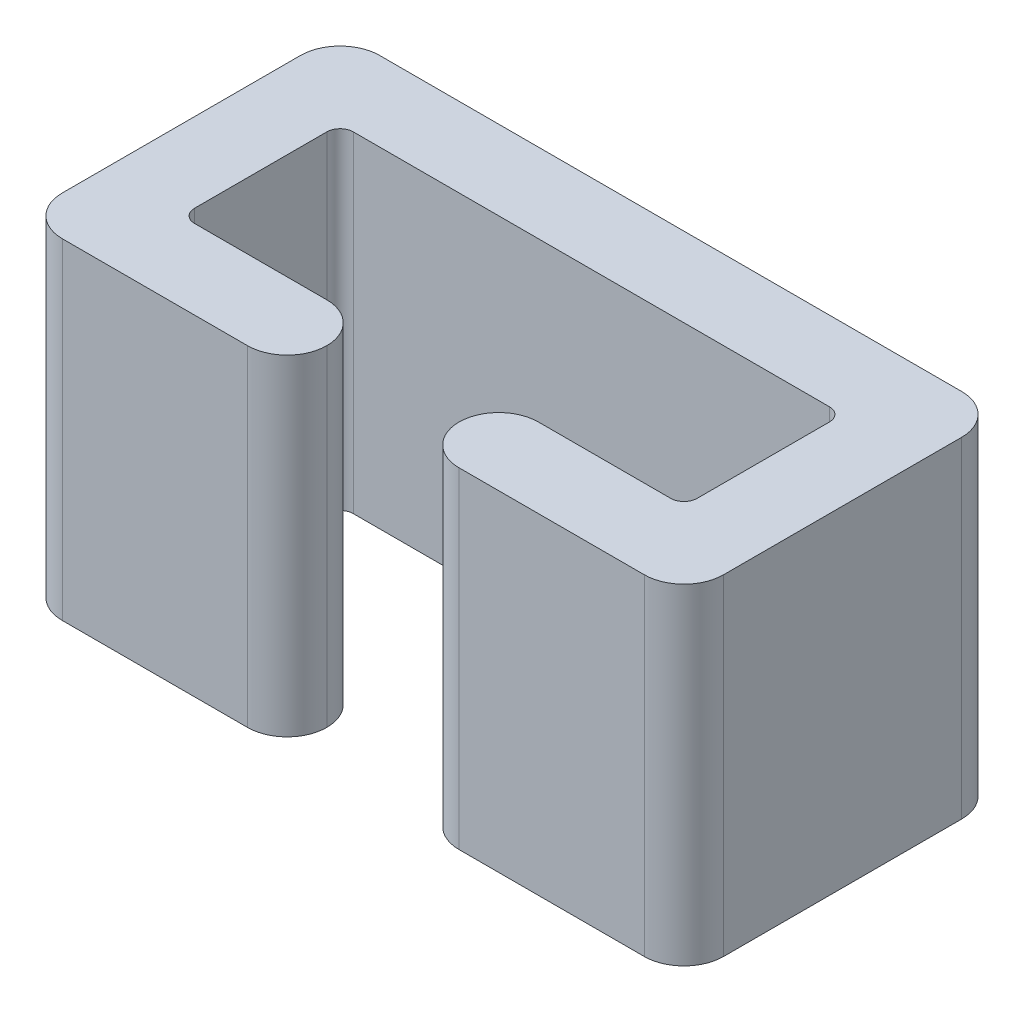
from build123d import *

# Parameters (mm, degrees)
BOSS_EXTRUDE1_DEPTH = 5
FILLET1_R           = 0.6
FILLET2_R           = 0.2


with BuildPart() as part:
    # Sketch1 → Boss-Extrude1 (new body)
    with BuildSketch(Plane(origin=(0, 0, 0), x_dir=(1, 0, 0), z_dir=(0, 1, 0))):
        Polygon((-5, 0), (5, 0), (5, -4.8), (1, -4.8), (1, -3.6), (3.8, -3.6), (3.8, -1.2), (-3.8, -1.2), (-3.8, -3.6), (-1, -3.6), (-1, -4.8), (-5, -4.8), align=None)
    extrude(amount=BOSS_EXTRUDE1_DEPTH)

    # Fillet1
    fillet1_edges = [part.edges().sort_by_distance(p)[0] for p in [
        (-5, 2.5, 0),
        (5, 2.5, 0),
        (5, 2.5, 4.8),
        (1, 2.5, 4.8),
        (1, 2.5, 3.6),
        (-1, 2.5, 3.6),
        (-1, 2.5, 4.8),
        (-5, 2.5, 4.8),
    ]]
    fillet(fillet1_edges, radius=FILLET1_R - 0.0001)  # a hair under: the kernel refuses the full size

    # Fillet2
    fillet2_edges = [part.edges().sort_by_distance(p)[0] for p in [
        (3.8, 2.5, 3.6),
        (3.8, 2.5, 1.2),
        (-3.8, 2.5, 1.2),
        (-3.8, 2.5, 3.6),
    ]]
    fillet(fillet2_edges, radius=FILLET2_R)


solid = part.part
